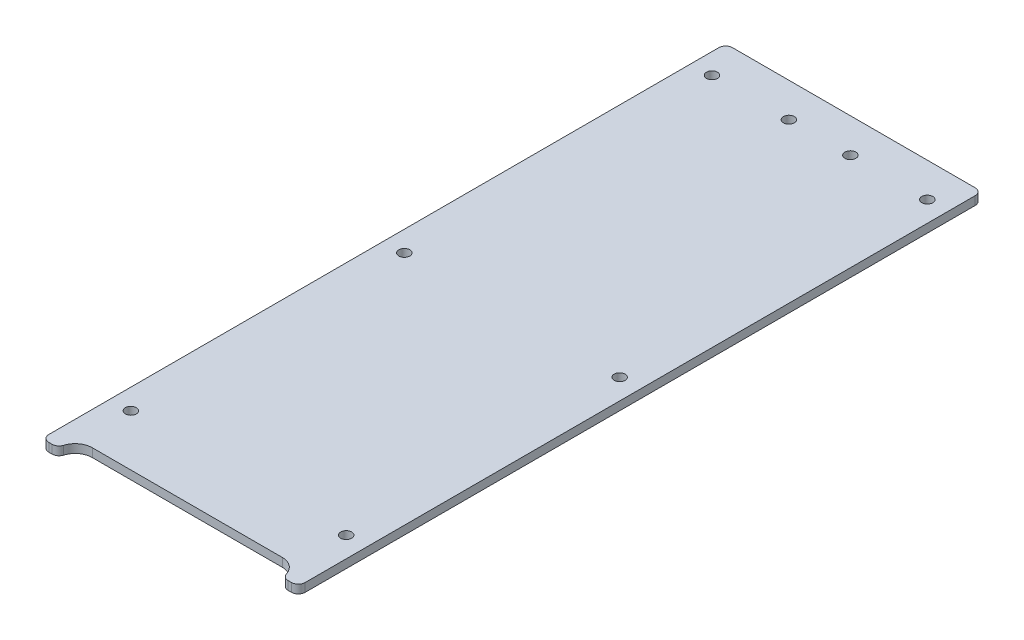
from build123d import *

# Parameters (mm, degrees)
SKETCH1_R           = 2.032
BOSS_EXTRUDE1_DEPTH = 3.175
FILLET1_R           = 2.54
FILLET2_R           = 2.54
FILLET3_R           = 6.35


with BuildPart() as part:
    # Sketch1 → Boss-Extrude1 (new body)
    with BuildSketch(Plane(origin=(0, 0, 0), x_dir=(1, 0, 0), z_dir=(0, 1, 0))):
        Polygon((47.625, 127), (-47.625, 127), (-47.625, -127), (-41.275, -127), (-41.275, -120.65), (41.275, -120.65), (41.275, -127), (47.625, -127), align=None)
        with Locations((-39.999684148, -101.6)):
            Circle(SKETCH1_R, mode=Mode.SUBTRACT)
        with Locations((39.999684148, -101.6)):
            Circle(SKETCH1_R, mode=Mode.SUBTRACT)
        with Locations((-39.999684148, 0)):
            Circle(SKETCH1_R, mode=Mode.SUBTRACT)
        with Locations((-39.999684148, 114.3)):
            Circle(SKETCH1_R, mode=Mode.SUBTRACT)
        with Locations((-11.424684148, 114.3)):
            Circle(SKETCH1_R, mode=Mode.SUBTRACT)
        with Locations((39.999684148, 0)):
            Circle(SKETCH1_R, mode=Mode.SUBTRACT)
        with Locations((11.424684148, 114.3)):
            Circle(SKETCH1_R, mode=Mode.SUBTRACT)
        with Locations((39.999684148, 114.3)):
            Circle(SKETCH1_R, mode=Mode.SUBTRACT)
    extrude(amount=BOSS_EXTRUDE1_DEPTH)

    # Fillet1
    fillet1_edges = [part.edges().sort_by_distance(p)[0] for p in [
        (-47.625, 1.5875, -127),
        (47.625, 1.5875, -127),
        (47.625, 1.5875, 127),
        (-47.625, 1.5875, 127),
    ]]
    fillet(fillet1_edges, radius=FILLET1_R)

    # Fillet2
    fillet2_edges = [part.edges().sort_by_distance(p)[0] for p in [
        (41.275, 1.5875, 127),
        (-41.275, 1.5875, 127),
    ]]
    fillet(fillet2_edges, radius=FILLET2_R)

    # Fillet3
    fillet3_edges = [part.edges().sort_by_distance(p)[0] for p in [
        (41.275, 1.5875, 120.65),
        (-41.275, 1.5875, 120.65),
    ]]
    fillet(fillet3_edges, radius=FILLET3_R)


solid = part.part
